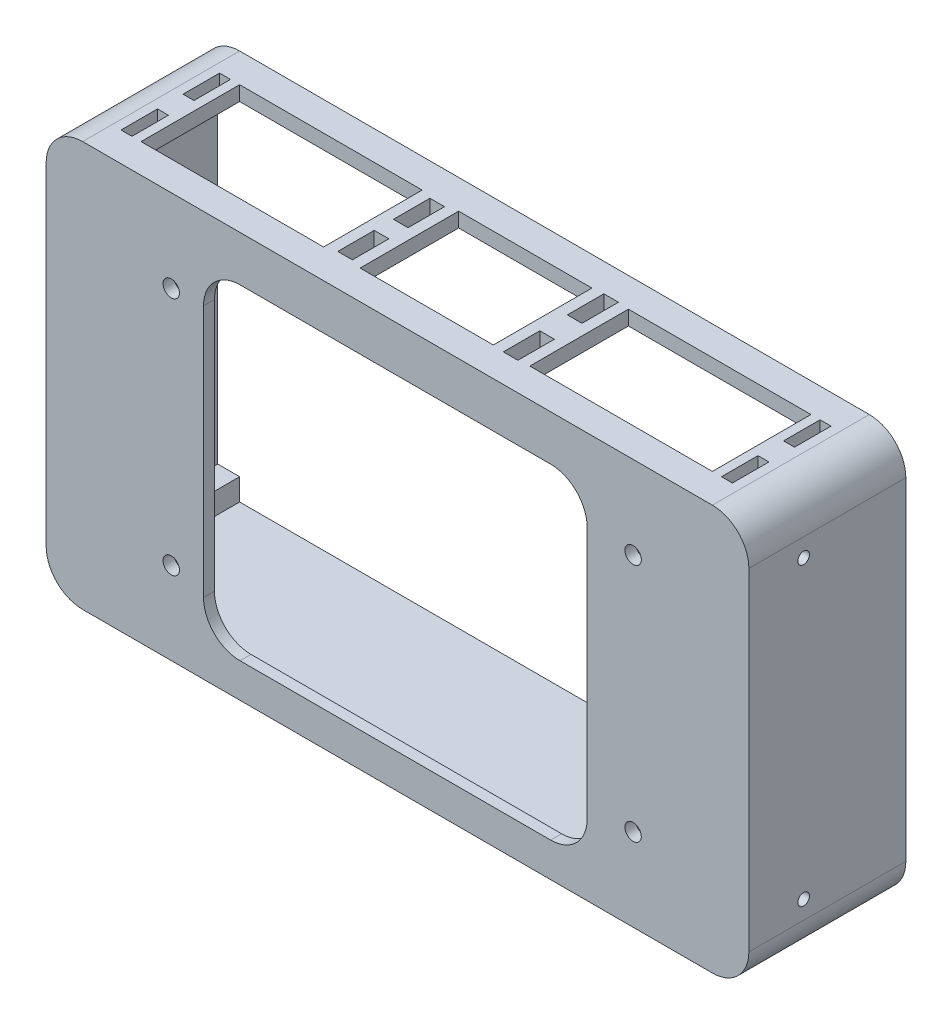
from build123d import *

# Parameters (mm, degrees)
SKETCH1_R           = 2.25
BOSS_EXTRUDE1_DEPTH = 3
BOSS_EXTRUDE3_DEPTH = 40
SKETCH4_W           = 6
SKETCH4_H           = 6
SKETCH4_R           = 1.6
BOSS_EXTRUDE4_DEPTH = 10
SKETCH5_W           = 6
SKETCH5_H           = 6
BOSS_EXTRUDE5_DEPTH = 2
FILLET3_R           = 10
SKETCH6_W           = 50
SKETCH6_H           = 27
SKETCH6_W_2         = 36.5
CUT_EXTRUDE1_DEPTH  = 5
SKETCH8_W           = 4
SKETCH8_H           = 10
SKETCH8_W_2         = 3
CUT_EXTRUDE2_DEPTH  = 5
SKETCH9_R           = 1.6
CUT_EXTRUDE3_DEPTH  = 252.455517463


with BuildPart() as part:
    # Sketch1 → Boss-Extrude1 (new body)
    with BuildSketch(Plane.XY):
        with BuildLine():
            Line((-13.577349449, 155.963544659), (-186.077349449, 155.963544659))
            ThreePointArc((-186.077349449, 155.963544659), (-193.148417261, 153.034612471), (-196.077349449, 145.963544659))
            Line((-196.077349449, 145.963544659), (-196.077349449, 54.963544659))
            ThreePointArc((-196.077349449, 54.963544659), (-193.148417261, 47.892476847), (-186.077349449, 44.963544659))
            Line((-186.077349449, 44.963544659), (-13.577349449, 44.963544659))
            ThreePointArc((-13.577349449, 44.963544659), (-6.506281637, 47.892476847), (-3.577349449, 54.963544659))
            Line((-3.577349449, 54.963544659), (-3.577349449, 145.963544659))
            ThreePointArc((-3.577349449, 145.963544659), (-6.506281637, 153.034612471), (-13.577349449, 155.963544659))
        make_face()
        with Locations((-35.292149682, 133.289732278)):
            Circle(SKETCH1_R, mode=Mode.SUBTRACT)
        with Locations((-35.297563809, 67.599891559)):
            Circle(SKETCH1_R, mode=Mode.SUBTRACT)
        with Locations((-161.808024727, 67.580045294)):
            Circle(SKETCH1_R, mode=Mode.SUBTRACT)
        with Locations((-161.808423577, 133.28851775)):
            Circle(SKETCH1_R, mode=Mode.SUBTRACT)
        with BuildLine():
            Line((-57.8741303, 143.534465984), (-142.973432949, 143.534465984))
            ThreePointArc((-142.973432949, 143.534465984), (-150.044500761, 140.605533796), (-152.973432949, 133.534465984))
            Line((-152.973432949, 133.534465984), (-152.973432949, 64.356832554))
            ThreePointArc((-152.973432949, 64.356832554), (-150.044500761, 57.285764742), (-142.973432949, 54.356832554))
            Line((-142.973432949, 54.356832554), (-57.8741303, 54.356832554))
            ThreePointArc((-57.8741303, 54.356832554), (-50.803062488, 57.285764742), (-47.8741303, 64.356832554))
            Line((-47.8741303, 64.356832554), (-47.8741303, 133.534465984))
            ThreePointArc((-47.8741303, 133.534465984), (-50.803062488, 140.605533796), (-57.8741303, 143.534465984))
        make_face(mode=Mode.SUBTRACT)
    extrude(amount=-BOSS_EXTRUDE1_DEPTH)

    # Sketch3 → Boss-Extrude3 (add)
    with BuildSketch(Plane(origin=(0, 0, -3), x_dir=(-1, 0, 0), z_dir=(0, 0, -1))):
        with BuildLine():
            Line((3.577349449, 145.963544659), (3.577349449, 54.963544659))
            ThreePointArc((3.577349449, 54.963544659), (6.506281637, 47.892476847), (13.577349449, 44.963544659))
            Line((13.577349449, 44.963544659), (99.827349449, 44.963544659))
            Line((99.827349449, 44.963544659), (186.077349449, 44.963544659))
            ThreePointArc((186.077349449, 44.963544659), (193.148417261, 47.892476847), (196.077349449, 54.963544659))
            Line((196.077349449, 54.963544659), (196.077349449, 145.963544659))
            ThreePointArc((196.077349449, 145.963544659), (193.148417261, 153.034612471), (186.077349449, 155.963544659))
            Line((186.077349449, 155.963544659), (99.827349449, 155.963544659))
            Line((99.827349449, 155.963544659), (13.577349449, 155.963544659))
            ThreePointArc((13.577349449, 155.963544659), (6.506281637, 153.034612471), (3.577349449, 145.963544659))
        make_face()
        Polygon((7.577349449, 151.963544659), (7.577349449, 48.963544659), (99.827349449, 48.963544659), (192.077349449, 48.963544659), (192.077349449, 151.963544659), (99.827349449, 151.963544659), align=None, mode=Mode.SUBTRACT)
    extrude(amount=BOSS_EXTRUDE3_DEPTH)

    # Sketch4 → Boss-Extrude4 (add)
    # profile 1 of 4: a face of its own
    with BuildSketch(Plane(origin=(0, 0, -43), x_dir=(-1, 0, 0), z_dir=(0, 0, -1))):
        with Locations((10.577349449, 148.963544659)):
            Rectangle(SKETCH4_W, SKETCH4_H)
        with Locations((10.577349449, 148.963544659)):
            Circle(SKETCH4_R, mode=Mode.SUBTRACT)
    # profile 2 of 4: a face of its own
    with BuildSketch(Plane(origin=(0, 0, -43), x_dir=(-1, 0, 0), z_dir=(0, 0, -1))):
        with Locations((189.077349449, 148.963544659)):
            Rectangle(SKETCH4_W, SKETCH4_H)
        with Locations(Location((189.077349449, 148.963544659, 0), (0, 0, 180))):
            Circle(SKETCH4_R, mode=Mode.SUBTRACT)
    # profile 3 of 4: a face of its own
    with BuildSketch(Plane(origin=(0, 0, -43), x_dir=(-1, 0, 0), z_dir=(0, 0, -1))):
        with Locations((189.077349449, 51.963544659)):
            Rectangle(SKETCH4_W, SKETCH4_H)
        with Locations(Location((189.077349449, 51.963544659, 0), (0, 0, 180))):
            Circle(SKETCH4_R, mode=Mode.SUBTRACT)
    # profile 4 of 4: a face of its own
    with BuildSketch(Plane(origin=(0, 0, -43), x_dir=(-1, 0, 0), z_dir=(0, 0, -1))):
        with Locations((10.577349449, 51.963544659)):
            Rectangle(SKETCH4_W, SKETCH4_H)
        with Locations((10.577349449, 51.963544659)):
            Circle(SKETCH4_R, mode=Mode.SUBTRACT)
    extrude(amount=-BOSS_EXTRUDE4_DEPTH)

    # Sketch5 → Boss-Extrude5 (add)
    with BuildSketch(Plane.XY.offset(-33)):
        with Locations((-189.077349449, 148.963544659)):
            Rectangle(SKETCH5_W, SKETCH5_H)
        with Locations((-189.077349449, 51.963544659)):
            Rectangle(SKETCH5_W, SKETCH5_H)
        with Locations((-10.577349449, 51.963544659)):
            Rectangle(SKETCH5_W, SKETCH5_H)
        with Locations((-10.577349449, 148.963544659)):
            Rectangle(SKETCH5_W, SKETCH5_H)
    extrude(amount=BOSS_EXTRUDE5_DEPTH)

    # Fillet3
    # the kernel refuses this fillet: 10 mm, written as the material it adds along each edge
    with BuildSketch(Plane(origin=(-192.077349449, 145.963544659, -31), x_dir=(1, 0, 0), z_dir=(0, 1, 0)), Plane(origin=(-7.577349449, 151.963544659, -31), x_dir=(-1, 0, 0), z_dir=(0, -1, 0))) as fillet3_piece_1:
        with BuildLine():
            CenterArc((10, -9.16515139), FILLET3_R, 113.578178478, 66.421821522)
            Line((0, -9.16515139), (-0.2, -9.16515139))
            Line((-0.2, -9.16515139), (-0.2, 0))
            Line((-0.2, 0), (0, 0.2))
            ThreePointArc((0, 0.2), (3, 0.2), (5.92, 0.183303028))
            Line((5.92, 0.183303028), (6, 0))
        make_face()
    extrude(amount=6)
    with BuildSketch(Plane(origin=(-192.077349449, 48.963544659, -31), x_dir=(0, 0, 1), z_dir=(0, 1, 0))) as fillet3_piece_2:
        with BuildLine():
            CenterArc((9.16515139, 10), FILLET3_R, 203.578178478, 66.421821522)
            Line((0, 6), (-0.183303028, 5.92))
            ThreePointArc((-0.183303028, 5.92), (-0.2, 3), (-0.2, 0))
            Line((-0.2, 0), (0, -0.2))
            Line((0, -0.2), (9.16515139, -0.2))
            Line((9.16515139, -0.2), (9.16515139, 0))
        make_face()
    extrude(amount=6)
    with BuildSketch(Plane(origin=(-7.577349449, 48.963544659, -31), x_dir=(-1, 0, 0), z_dir=(0, 1, 0))) as fillet3_piece_3:
        with BuildLine():
            CenterArc((10, 9.16515139), FILLET3_R, 180, 66.421821522)
            Line((0, 9.16515139), (-0.2, 9.16515139))
            Line((-0.2, 9.16515139), (-0.2, 0))
            Line((-0.2, 0), (0, -0.2))
            ThreePointArc((0, -0.2), (3, -0.2), (5.92, -0.183303028))
            Line((5.92, -0.183303028), (6, 0))
        make_face()
    extrude(amount=6)

    # Sketch6 → Cut-Extrude1 (cut)
    with BuildSketch(Plane(origin=(0, 155.963544659, 0), x_dir=(1, 0, 0), z_dir=(0, 1, 0))):
        with Locations((-153.077349449, 21.5)):
            Rectangle(SKETCH6_W, SKETCH6_H)
        with Locations((-99.827349449, 21.5)):
            Rectangle(SKETCH6_W_2, SKETCH6_H)
        with Locations((-46.577349449, 21.5)):
            Rectangle(SKETCH6_W, SKETCH6_H)
    extrude(amount=-CUT_EXTRUDE1_DEPTH, mode=Mode.SUBTRACT)

    # Sketch8 → Cut-Extrude2 (cut)
    with BuildSketch(Plane(origin=(0, 155.963544659, 0), x_dir=(1, 0, 0), z_dir=(0, 1, 0))):
        with Locations((-123.077349449, 13.876287988)):
            Rectangle(SKETCH8_W, SKETCH8_H)
        with Locations((-76.577349449, 12.724006881)):
            Rectangle(SKETCH8_W, SKETCH8_H)
        with Locations((-76.577349449, 30.275993119)):
            Rectangle(SKETCH8_W, SKETCH8_H)
        with Locations((-123.077349449, 29.123712012)):
            Rectangle(SKETCH8_W, SKETCH8_H)
        with Locations((-17.577349449, 13)):
            Rectangle(SKETCH8_W_2, SKETCH8_H)
        with Locations((-182.077349449, 13)):
            Rectangle(SKETCH8_W_2, SKETCH8_H)
        with Locations((-17.577349449, 30)):
            Rectangle(SKETCH8_W_2, SKETCH8_H)
        with Locations((-182.077349449, 30)):
            Rectangle(SKETCH8_W_2, SKETCH8_H)
    extrude(amount=-CUT_EXTRUDE2_DEPTH, mode=Mode.SUBTRACT)

    # Sketch9 → Cut-Extrude3 (cut, through all)
    with BuildSketch(Plane(origin=(-3.577349449, 0, 0), x_dir=(0, 0, -1), z_dir=(1, 0, 0))):
        with Locations(Location((15, 140.963544659, 0), (0, 0, 90))):
            Circle(SKETCH9_R)
        with Locations(Location((15, 59.963544659, 0), (0, 0, 90))):
            Circle(SKETCH9_R)
    extrude(amount=-CUT_EXTRUDE3_DEPTH, mode=Mode.SUBTRACT)


solid = part.part
